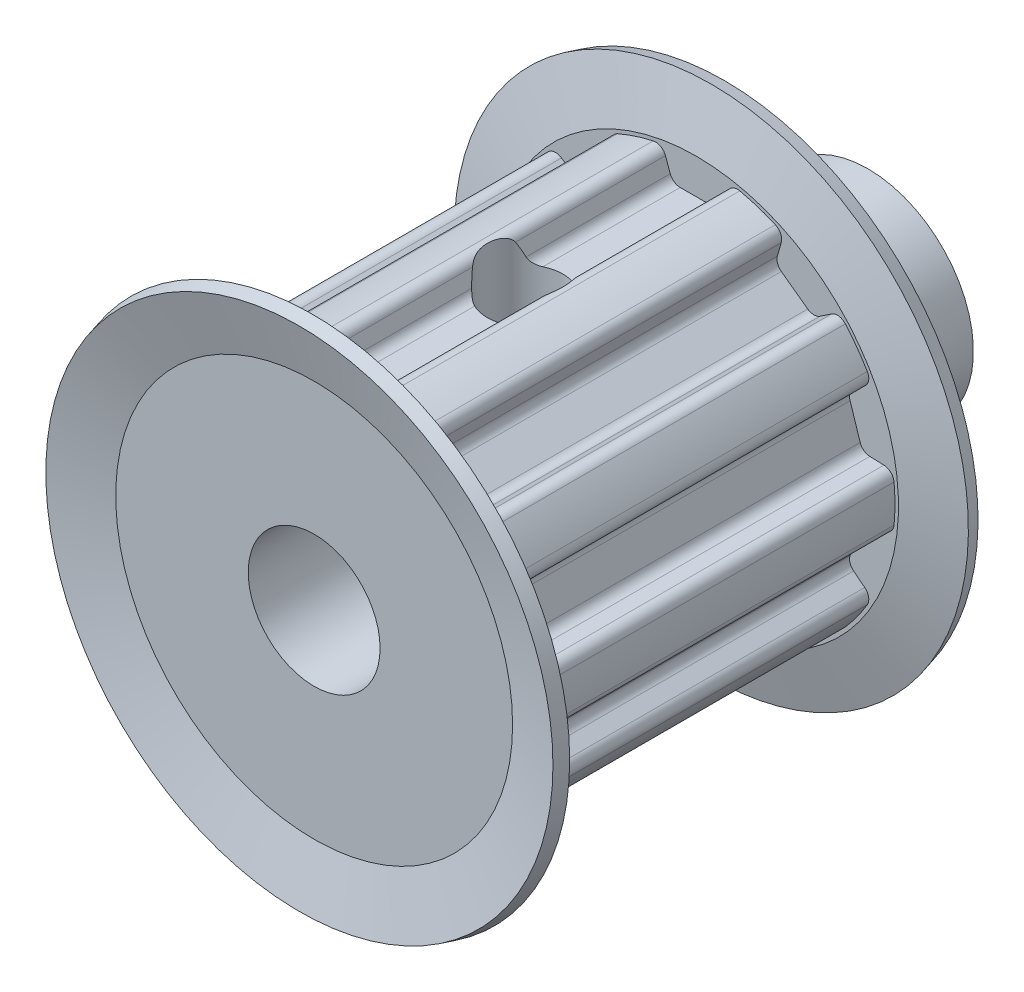
from build123d import *

# Parameters (mm, degrees)
SKETCH5_W                   = 15
SKETCH5_H                   = 7.525
CUT_EXTRUDE_START           = -15
CUT_EXTRUDE_1_OUTLINE_R     = 2.5
CUT_EXTRUDE_1_DEPTH         = 15
CUT_EXTRUDE_START_2         = -21
CUT_EXTRUDE_1_2_OUTLINE_R   = 4
CUT_EXTRUDE_1_2_OUTLINE_R_2 = 2.5
CUT_EXTRUDE_1_2_DEPTH       = 6
CUT_EXTRUDE_START_3         = -14.5
CUT_EXTRUDE_1_3_DEPTH       = 14
CUT_EXTRUDE_START_4         = 1
CUT_EXTRUDE_1_5_OUTLINE_R   = 1.433256124
CUT_EXTRUDE_1_5_DEPTH       = 6.353381724


with BuildPart() as part:
    # Sketch5 → body (revolve)
    with BuildSketch(Plane(origin=(0, 0, 0), x_dir=(0, 0, -1), z_dir=(1, 0, 0)), mode=Mode.PRIVATE) as body_sk:
        with Locations((7.5, 3.7625)):
            Rectangle(SKETCH5_W, SKETCH5_H)
    revolve(body_sk.sketch.rotate(Axis((0, 0, 0), (0, 0, 1)), 270), axis=Axis((0, 0, 0), (0, 0, 1)))

    # Вырез-Вытянуть1: read off the stored shape, not the designer's step
    # Вырез-Вытянуть1 outline → Вырез-Вытянуть1 (cut)
    with BuildSketch(Plane.XY.offset(CUT_EXTRUDE_START)):
        Circle(CUT_EXTRUDE_1_OUTLINE_R)
    extrude(amount=CUT_EXTRUDE_1_DEPTH, mode=Mode.SUBTRACT)

    # Cut-Extrude 1 2 outline → Cut-Extrude 1 2 (add)
    with BuildSketch(Plane.XY.offset(CUT_EXTRUDE_START_2)):
        Circle(CUT_EXTRUDE_1_2_OUTLINE_R)
        Circle(CUT_EXTRUDE_1_2_OUTLINE_R_2, mode=Mode.SUBTRACT)
    extrude(amount=CUT_EXTRUDE_1_2_DEPTH)

    # Cut-Extrude 1 3 outline → Cut-Extrude 1 3 (cut)
    with BuildSketch(Plane.XY.offset(CUT_EXTRUDE_START_3)):
        with BuildLine():
            ThreePointArc((1.178506304, 7.090189781), (1.362296798, 7.304241747), (1.641646979, 7.343747013))
            ThreePointArc((1.641646979, 7.343747013), (0, 7.525), (-1.641646979, 7.343747013))
            ThreePointArc((-1.641646979, 7.343747013), (-1.362296798, 7.304241747), (-1.178506304, 7.090189781))
            Line((-1.178506304, 7.090189781), (-0.995794033, 6.588191943))
            ThreePointArc((-0.995794033, 6.588191943), (-0.84934756, 6.397339182), (-0.619916985, 6.325))
            Line((-0.619916985, 6.325), (0.619916985, 6.325))
            ThreePointArc((0.619916985, 6.325), (0.84934756, 6.397339182), (0.995794033, 6.588191943))
            Line((0.995794033, 6.588191943), (1.178506304, 7.090189781))
        make_face()
        with BuildLine():
            ThreePointArc((5.644666496, 4.976280253), (4.423084023, 6.087852883), (2.988425886, 6.90615202))
            ThreePointArc((2.988425886, 6.90615202), (3.191204317, 6.709993671), (3.214077361, 6.428792651))
            Line((3.214077361, 6.428792651), (3.066827768, 5.915272291))
            ThreePointArc((3.066827768, 5.915272291), (3.073125016, 5.674790087), (3.216218345, 5.481410551))
            Line((3.216218345, 5.481410551), (4.219265096, 4.752654428))
            ThreePointArc((4.219265096, 4.752654428), (4.447398235, 4.676322148), (4.678056359, 4.744646197))
            Line((4.678056359, 4.744646197), (5.120940617, 5.043375401))
            ThreePointArc((5.120940617, 5.043375401), (5.395446839, 5.108517737), (5.644666496, 4.976280253))
        make_face()
        with BuildLine():
            ThreePointArc((-3.214077361, 6.428792651), (-3.191204317, 6.709993671), (-2.988425886, 6.90615202))
            ThreePointArc((-2.988425886, 6.90615202), (-4.423084023, 6.087852883), (-5.644666496, 4.976280253))
            ThreePointArc((-5.644666496, 4.976280253), (-5.395446839, 5.108517737), (-5.120940617, 5.043375401))
            Line((-5.120940617, 5.043375401), (-4.678056359, 4.744646197))
            ThreePointArc((-4.678056359, 4.744646197), (-4.447398235, 4.676322148), (-4.219265096, 4.752654428))
            Line((-4.219265096, 4.752654428), (-3.216218345, 5.481410551))
            ThreePointArc((-3.216218345, 5.481410551), (-3.073125016, 5.674790087), (-3.066827768, 5.915272291))
            Line((-3.066827768, 5.915272291), (-3.214077361, 6.428792651))
        make_face()
        with BuildLine():
            ThreePointArc((7.491615266, 0.708043573), (7.156700285, 2.325352883), (6.477021636, 3.830641686))
            ThreePointArc((6.477021636, 3.830641686), (6.525773848, 3.552756077), (6.378992717, 3.311815235))
            Line((6.378992717, 3.311815235), (5.958025599, 2.982919676))
            ThreePointArc((5.958025599, 2.982919676), (5.821768286, 2.784664057), (5.823867582, 2.544108577))
            Line((5.823867582, 2.544108577), (6.206997349, 1.364956402))
            ThreePointArc((6.206997349, 1.364956402), (6.346693946, 1.169108995), (6.573460157, 1.088806868))
            Line((6.573460157, 1.088806868), (7.107349669, 1.070163036))
            ThreePointArc((7.107349669, 1.070163036), (7.367719572, 0.961513584), (7.491615266, 0.708043573))
        make_face()
        with BuildLine():
            ThreePointArc((-6.378992717, 3.311815235), (-6.525773848, 3.552756077), (-6.477021636, 3.830641686))
            ThreePointArc((-6.477021636, 3.830641686), (-7.156700285, 2.325352883), (-7.491615266, 0.708043573))
            ThreePointArc((-7.491615266, 0.708043573), (-7.367719572, 0.961513584), (-7.107349669, 1.070163036))
            Line((-7.107349669, 1.070163036), (-6.573460157, 1.088806868))
            ThreePointArc((-6.573460157, 1.088806868), (-6.346693946, 1.169108995), (-6.206997349, 1.364956402))
            Line((-6.206997349, 1.364956402), (-5.823867582, 2.544108577))
            ThreePointArc((-5.823867582, 2.544108577), (-5.821768286, 2.784664057), (-5.958025599, 2.982919676))
            Line((-5.958025599, 2.982919676), (-6.378992717, 3.311815235))
        make_face()
        with BuildLine():
            ThreePointArc((6.477021636, -3.830641686), (7.156700285, -2.325352883), (7.491615266, -0.708043573))
            ThreePointArc((7.491615266, -0.708043573), (7.367719572, -0.961513584), (7.107349669, -1.070163036))
            Line((7.107349669, -1.070163036), (6.573460157, -1.088806868))
            ThreePointArc((6.573460157, -1.088806868), (6.346693946, -1.169108995), (6.206997349, -1.364956402))
            Line((6.206997349, -1.364956402), (5.823867582, -2.544108577))
            ThreePointArc((5.823867582, -2.544108577), (5.821768286, -2.784664057), (5.958025599, -2.982919676))
            Line((5.958025599, -2.982919676), (6.378992717, -3.311815235))
            ThreePointArc((6.378992717, -3.311815235), (6.525773848, -3.552756077), (6.477021636, -3.830641686))
        make_face()
        with BuildLine():
            ThreePointArc((-7.107349669, -1.070163036), (-7.367719572, -0.961513584), (-7.491615266, -0.708043573))
            ThreePointArc((-7.491615266, -0.708043573), (-7.156700285, -2.325352883), (-6.477021636, -3.830641686))
            ThreePointArc((-6.477021636, -3.830641686), (-6.525773848, -3.552756077), (-6.378992717, -3.311815235))
            Line((-6.378992717, -3.311815235), (-5.958025599, -2.982919676))
            ThreePointArc((-5.958025599, -2.982919676), (-5.821768286, -2.784664057), (-5.823867582, -2.544108577))
            Line((-5.823867582, -2.544108577), (-6.206997349, -1.364956402))
            ThreePointArc((-6.206997349, -1.364956402), (-6.346693946, -1.169108995), (-6.573460157, -1.088806868))
            Line((-6.573460157, -1.088806868), (-7.107349669, -1.070163036))
        make_face()
        with BuildLine():
            ThreePointArc((2.988425886, -6.90615202), (4.423084023, -6.087852883), (5.644666496, -4.976280253))
            ThreePointArc((5.644666496, -4.976280253), (5.395446839, -5.108517737), (5.120940617, -5.043375401))
            Line((5.120940617, -5.043375401), (4.678056359, -4.744646197))
            ThreePointArc((4.678056359, -4.744646197), (4.447398235, -4.676322148), (4.219265096, -4.752654428))
            Line((4.219265096, -4.752654428), (3.216218345, -5.481410551))
            ThreePointArc((3.216218345, -5.481410551), (3.073125016, -5.674790087), (3.066827768, -5.915272291))
            Line((3.066827768, -5.915272291), (3.214077361, -6.428792651))
            ThreePointArc((3.214077361, -6.428792651), (3.191204317, -6.709993671), (2.988425886, -6.90615202))
        make_face()
        with BuildLine():
            ThreePointArc((-5.120940617, -5.043375401), (-5.395446839, -5.108517737), (-5.644666496, -4.976280253))
            ThreePointArc((-5.644666496, -4.976280253), (-4.423084023, -6.087852883), (-2.988425886, -6.90615202))
            ThreePointArc((-2.988425886, -6.90615202), (-3.191204317, -6.709993671), (-3.214077361, -6.428792651))
            Line((-3.214077361, -6.428792651), (-3.066827768, -5.915272291))
            ThreePointArc((-3.066827768, -5.915272291), (-3.073125016, -5.674790087), (-3.216218345, -5.481410551))
            Line((-3.216218345, -5.481410551), (-4.219265096, -4.752654428))
            ThreePointArc((-4.219265096, -4.752654428), (-4.447398235, -4.676322148), (-4.678056359, -4.744646197))
            Line((-4.678056359, -4.744646197), (-5.120940617, -5.043375401))
        make_face()
        with BuildLine():
            ThreePointArc((-1.641646979, -7.343747013), (0, -7.525), (1.641646979, -7.343747013))
            ThreePointArc((1.641646979, -7.343747013), (1.362296798, -7.304241747), (1.178506304, -7.090189781))
            Line((1.178506304, -7.090189781), (0.995794033, -6.588191943))
            ThreePointArc((0.995794033, -6.588191943), (0.84934756, -6.397339182), (0.619916985, -6.325))
            Line((0.619916985, -6.325), (-0.619916985, -6.325))
            ThreePointArc((-0.619916985, -6.325), (-0.84934756, -6.397339182), (-0.995794033, -6.588191943))
            Line((-0.995794033, -6.588191943), (-1.178506304, -7.090189781))
            ThreePointArc((-1.178506304, -7.090189781), (-1.362296798, -7.304241747), (-1.641646979, -7.343747013))
        make_face()
    extrude(amount=CUT_EXTRUDE_1_3_DEPTH, mode=Mode.SUBTRACT)

    # Cut-Extrude 1 4 outline → Cut-Extrude 1 4 (revolve)
    with BuildSketch(Plane.XZ):
        Polygon((7.525, 0), (7.525, -0.5), (7.658974596, -0.5), (9.75, 0.060288568), (9.616025404, 0.560288568), align=None)
        Polygon((7.658974596, -14.5), (7.525, -14.5), (7.525, -15), (9.616025404, -15.560288568), (9.75, -15.060288568), align=None)
    revolve(axis=Axis((0, 0, 0), (0, 0, 1)))

    # Cut-Extrude 1 5 outline → Cut-Extrude 1 5 (cut)
    with BuildSketch(Plane(origin=(0, 0, 0), x_dir=(1, 0, 0), z_dir=(0, 1, 0)).offset(CUT_EXTRUDE_START_4)):
        with Locations((0, 8)):
            Circle(CUT_EXTRUDE_1_5_OUTLINE_R)
    extrude(amount=CUT_EXTRUDE_1_5_DEPTH, mode=Mode.SUBTRACT)


solid = part.part
